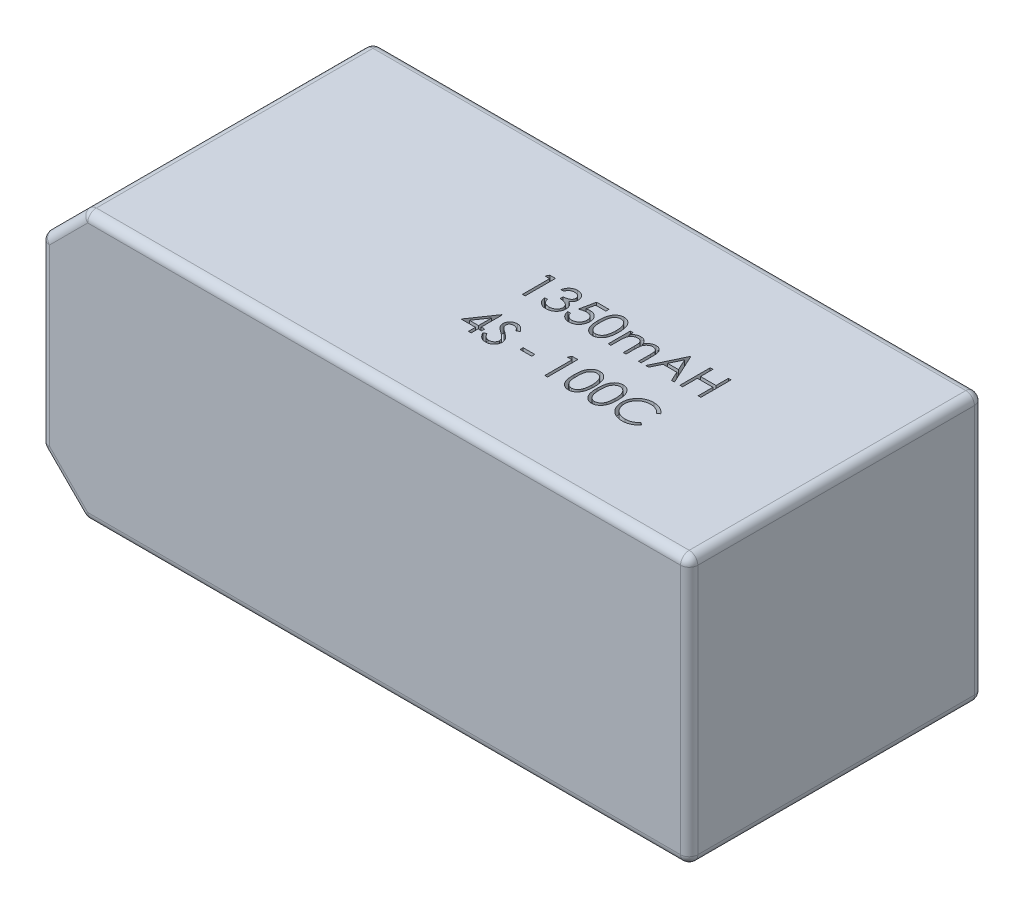
from build123d import *

# Parameters (mm, degrees)
SKETCH1_W           = 75
SKETCH1_H           = 34
BOSS_EXTRUDE1_DEPTH = 15.5
CHAMFER1_SIZE       = 5
FILLET1_R           = 1
SKETCH2_W           = 1.346153846
SKETCH2_H           = 0.358974359
CUT_EXTRUDE1_DEPTH  = 1


with BuildPart() as part:
    # Sketch1 → Boss-Extrude1 (new, symmetric)
    with BuildSketch(Plane(origin=(0, 0, 0), x_dir=(1, 0, 0), z_dir=(0, 1, 0))):
        Rectangle(SKETCH1_W, SKETCH1_H)
    extrude(amount=BOSS_EXTRUDE1_DEPTH, both=True)

    # Chamfer1
    chamfer1_edges = [part.edges().sort_by_distance(p)[0] for p in [
        (-37.5, 15.5, 0),
        (-37.5, -15.5, 0),
    ]]
    chamfer(chamfer1_edges, length=CHAMFER1_SIZE)

    # Fillet1
    fillet1_edges = [part.edges().sort_by_distance(p)[0] for p in [
        (37.5, -15.5, 0),
        (37.5, 15.5, 0),
        (-35, -13, -17),
        (-37.5, 0, -17),
        (-35, 13, -17),
        (2.5, -15.5, -17),
        (37.5, 0, -17),
        (2.5, 15.5, -17),
        (-35, -13, 17),
        (-37.5, 0, 17),
        (-35, 13, 17),
        (37.5, 0, 17),
        (2.5, 15.5, 17),
        (2.5, -15.5, 17),
        (-32.5, -15.5, 0),
        (-37.5, -10.5, 0),
        (-32.5, 15.5, 0),
        (-37.5, 10.5, 0),
    ]]
    fillet(fillet1_edges, radius=FILLET1_R)

    # Sketch2 → Cut-Extrude1 (cut)
    # profile 1 of 14: a face of its own
    with BuildSketch(Plane(origin=(0, 15.5, 0), x_dir=(1, 0, 0), z_dir=(0, 1, 0))):
        Polygon((0.878505609, 3.5), (1.525641026, 3.5), (1.525641026, 0), (1.211538462, 0), (1.211538462, 3.141025641), (0.673076923, 3.141025641), align=None)
    # profile 2 of 14: a face of its own
    with BuildSketch(Plane(origin=(0, 15.5, 0), x_dir=(1, 0, 0), z_dir=(0, 1, 0))):
        with BuildLine():
            Line((3.275641026, 2.692307692), (2.961538462, 2.692307692))
            add(Edge.make_bspline(
                [(2.961538462, 2.692307692), (2.970048012, 2.727540176), (2.986683488, 2.796416801), (3.021381061, 2.894824062), (3.059180316, 2.987947583), (3.104569421, 3.074043657), (3.154078175, 3.154842559), (3.210800897, 3.228511684), (3.272120619, 3.296924649), (3.339945569, 3.357637887), (3.41107423, 3.412615616), (3.48650885, 3.459490673), (3.564731744, 3.499814826), (3.646284877, 3.533035058), (3.731411048, 3.558060582), (3.819340672, 3.576217387), (3.910304172, 3.588008502), (3.972051762, 3.589159265), (4.003405449, 3.58974359)],
                knots=[0, 0, 0, 0, 1.162005537, 2.271625781, 3.343758855, 4.383309926, 5.390229558, 6.379919256, 7.361854164, 8.333198761, 9.295911338, 10.242430842, 11.177959212, 12.116337295, 13.062827104, 14.020064771, 14.994644689, 16, 16, 16, 16], degree=3))
            add(Edge.make_bspline(
                [(4.003405449, 3.58974359), (4.049088191, 3.588364359), (4.139457202, 3.585635984), (4.272220249, 3.560721548), (4.400247068, 3.521296415), (4.522136316, 3.466822688), (4.635354748, 3.399635375), (4.736090935, 3.319670638), (4.822979446, 3.228471337), (4.895873823, 3.127738772), (4.952948822, 3.020083263), (4.995035196, 2.909283106), (5.020656877, 2.795601134), (5.023977434, 2.718843855), (5.025641026, 2.680388622)],
                knots=[0, 0, 0, 0, 1.083050992, 2.142477498, 3.193116406, 4.255571735, 5.30263384, 6.308962982, 7.297363603, 8.282367274, 9.249857812, 10.179914175, 11.08814088, 12, 12, 12, 12], degree=3))
            add(Edge.make_bspline(
                [(5.025641026, 2.680388622), (5.024477435, 2.643381827), (5.022200467, 2.570965273), (5.002866762, 2.465243775), (4.970330499, 2.365602175), (4.925260736, 2.271621013), (4.866919186, 2.183896173), (4.796246489, 2.102230282), (4.712743828, 2.026261124), (4.64946489, 1.982741651), (4.616887019, 1.960336538)],
                knots=[0, 0, 0, 0, 1.024540389, 2.004866551, 2.965041327, 3.920577974, 4.882998113, 5.874504559, 6.905732034, 8, 8, 8, 8], degree=3))
            add(Edge.make_bspline(
                [(4.616887019, 1.960336538), (4.654118774, 1.942358367), (4.727885648, 1.906738409), (4.828436178, 1.836882652), (4.919714053, 1.756226304), (4.970617772, 1.693283652), (4.99619391, 1.661658654)],
                knots=[0, 0, 0, 0, 1.015518401, 2.012035669, 3.001164323, 4, 4, 4, 4], degree=3))
            add(Edge.make_bspline(
                [(4.99619391, 1.661658654), (5.013035253, 1.638600902), (5.046442149, 1.592862986), (5.087677682, 1.51932656), (5.125086797, 1.444975071), (5.154237016, 1.367815664), (5.176810883, 1.288742651), (5.192946915, 1.207620255), (5.202971056, 1.124382232), (5.204406608, 1.068069752), (5.205128205, 1.039763622)],
                knots=[0, 0, 0, 0, 1.025084078, 2.033381695, 3.024893161, 4.013698104, 4.991890475, 5.976764909, 6.982997093, 8, 8, 8, 8], degree=3))
            add(Edge.make_bspline(
                [(5.205128205, 1.039763622), (5.203333692, 0.990753901), (5.19975311, 0.892965099), (5.167749035, 0.748490377), (5.118135795, 0.607264875), (5.047678859, 0.472190036), (4.96181135, 0.345809655), (4.859654026, 0.232733346), (4.742367617, 0.135534741), (4.611561968, 0.054324513), (4.46984484, -0.010593409), (4.318269248, -0.055650852), (4.159019194, -0.084996852), (4.049811896, -0.08814372), (3.994290865, -0.08974359)],
                knots=[0, 0, 0, 0, 0.955779014, 1.907060117, 2.875433937, 3.871313158, 4.872415639, 5.851225146, 6.836215519, 7.83643374, 8.849228613, 9.86973379, 10.916971861, 12, 12, 12, 12], degree=3))
            add(Edge.make_bspline(
                [(3.994290865, -0.08974359), (3.956871565, -0.088875376), (3.88324286, -0.087167022), (3.774999362, -0.075488421), (3.671677662, -0.054158416), (3.573138064, -0.025455111), (3.479293028, 0.010936632), (3.390428923, 0.05625533), (3.305999029, 0.109566832), (3.226800078, 0.171500419), (3.15284151, 0.240781759), (3.086088786, 0.318640769), (3.025428993, 0.403638173), (2.972486355, 0.496761229), (2.924849402, 0.596806487), (2.885668445, 0.705054985), (2.851182877, 0.820539007), (2.835149412, 0.901016747), (2.826923077, 0.942307692)],
                knots=[0, 0, 0, 0, 1.048658725, 2.063410685, 3.046034179, 4.001477787, 4.936774919, 5.862367409, 6.792675028, 7.730719943, 8.675894397, 9.627829632, 10.600096036, 11.597688215, 12.626045268, 13.701542398, 14.82072376, 16, 16, 16, 16], degree=3))
            Line((2.826923077, 0.942307692), (3.141025641, 0.942307692))
            add(Edge.make_bspline(
                [(3.141025641, 0.942307692), (3.149208932, 0.915358679), (3.165126145, 0.862940507), (3.192220443, 0.787500202), (3.223088715, 0.718342149), (3.256203274, 0.654959027), (3.29098172, 0.596726624), (3.329896645, 0.545184755), (3.37006579, 0.498069553), (3.400345144, 0.471524941), (3.415164263, 0.458533654)],
                knots=[0, 0, 0, 0, 1.198163088, 2.33053128, 3.407730985, 4.417276592, 5.372219308, 6.28897303, 7.162600585, 8, 8, 8, 8], degree=3))
            add(Edge.make_bspline(
                [(3.415164263, 0.458533654), (3.434760839, 0.44342532), (3.473893502, 0.413255288), (3.537661733, 0.37475366), (3.604726619, 0.341392634), (3.676541294, 0.315908939), (3.751556064, 0.294331278), (3.830983429, 0.280210759), (3.914122646, 0.270522587), (3.97089041, 0.269667656), (3.99989984, 0.269230769)],
                knots=[0, 0, 0, 0, 0.946170439, 1.889420265, 2.845303464, 3.807233317, 4.801018734, 5.828864929, 6.890507805, 8, 8, 8, 8], degree=3))
            add(Edge.make_bspline(
                [(3.99989984, 0.269230769), (4.032653342, 0.269846674), (4.096699989, 0.271051024), (4.190154849, 0.282126731), (4.279062296, 0.298257144), (4.362435222, 0.323170127), (4.441365729, 0.353950979), (4.514747379, 0.392599384), (4.583543485, 0.437944106), (4.646872891, 0.489483264), (4.703818398, 0.545904759), (4.753957911, 0.60491783), (4.796582573, 0.66627366), (4.830966151, 0.730311781), (4.858116701, 0.79676701), (4.876599902, 0.865825839), (4.889451417, 0.936923105), (4.890498029, 0.985252074), (4.891025641, 1.009615385)],
                knots=[0, 0, 0, 0, 1.217147791, 2.380027433, 3.494444702, 4.572153297, 5.609568379, 6.639424714, 7.649109417, 8.668170816, 9.669597737, 10.625200337, 11.543417969, 12.441394052, 13.322311151, 14.205496177, 15.095365482, 16, 16, 16, 16], degree=3))
            add(Edge.make_bspline(
                [(4.891025641, 1.009615385), (4.889495339, 1.042226723), (4.886442351, 1.107287132), (4.863133772, 1.203004706), (4.824794907, 1.295228118), (4.771122396, 1.382383909), (4.705786667, 1.46315981), (4.629421761, 1.535231293), (4.541393532, 1.594701384), (4.460373663, 1.63579004), (4.388608507, 1.663827115), (4.327193122, 1.68250208), (4.258436519, 1.698315735), (4.18317017, 1.713028007), (4.100826954, 1.725549355), (4.011496516, 1.735991171), (3.915160754, 1.744346212), (3.848469588, 1.748077307), (3.814102564, 1.75)],
                knots=[0, 0, 0, 0, 1.07054697, 2.135767047, 3.216561865, 4.33974944, 5.486079747, 6.621378074, 7.775625952, 8.963672916, 9.598146892, 10.304877434, 11.070270905, 11.915000392, 12.823868403, 13.805723172, 14.86925407, 16, 16, 16, 16], degree=3))
            Line((3.814102564, 1.75), (3.814102564, 2.108974359))
            add(Edge.make_bspline(
                [(3.814102564, 2.108974359), (3.85740373, 2.109709163), (3.942220076, 2.111148463), (4.066114381, 2.128556473), (4.184587693, 2.152637101), (4.295014435, 2.189522293), (4.395663149, 2.23236259), (4.482982751, 2.2822148), (4.555749898, 2.337629549), (4.613610969, 2.399462158), (4.657140198, 2.465777206), (4.688966996, 2.534893864), (4.707767322, 2.607417924), (4.710276989, 2.656912592), (4.711538462, 2.681790865)],
                knots=[0, 0, 0, 0, 1.321986639, 2.589447074, 3.816329219, 5.01088745, 6.139805852, 7.153945165, 8.075214402, 8.924034688, 9.728124013, 10.488707548, 11.240355623, 12, 12, 12, 12], degree=3))
            add(Edge.make_bspline(
                [(4.711538462, 2.681790865), (4.711124051, 2.700068611), (4.7102996, 2.736431318), (4.699902322, 2.789556386), (4.684278281, 2.841057332), (4.662798552, 2.890715142), (4.634048353, 2.938185416), (4.599642366, 2.983872865), (4.558674266, 3.027516644), (4.511728819, 3.068196964), (4.461317014, 3.106966201), (4.406067239, 3.139879838), (4.347645364, 3.1680249), (4.285986709, 3.191234402), (4.220891179, 3.20869369), (4.152664621, 3.221229532), (4.081176938, 3.229067187), (4.032405206, 3.230195602), (4.007612179, 3.230769231)],
                knots=[0, 0, 0, 0, 0.884392785, 1.759457502, 2.611959086, 3.489218968, 4.37281399, 5.2945488, 6.255912374, 7.266815255, 8.301784654, 9.332968512, 10.37626691, 11.440494194, 12.520033166, 13.637162961, 14.798855837, 16, 16, 16, 16], degree=3))
            add(Edge.make_bspline(
                [(4.007612179, 3.230769231), (3.967760511, 3.229377869), (3.889920935, 3.226660215), (3.777706018, 3.202857202), (3.673386684, 3.164879118), (3.593648018, 3.119546099), (3.534765443, 3.074795665), (3.492688505, 3.035713279), (3.451367995, 2.992280455), (3.413522318, 2.94182208), (3.375248341, 2.887755289), (3.34040378, 2.827331608), (3.306544088, 2.762127214), (3.286141538, 2.716031579), (3.275641026, 2.692307692)],
                knots=[0, 0, 0, 0, 1.472543308, 2.876219568, 4.221790263, 5.565193594, 6.249813518, 6.953379497, 7.687249741, 8.463570142, 9.283606569, 10.136032583, 11.040678096, 12, 12, 12, 12], degree=3))
        make_face()
    # profile 3 of 14: a face of its own
    with BuildSketch(Plane(origin=(0, 15.5, 0), x_dir=(1, 0, 0), z_dir=(0, 1, 0))):
        with BuildLine():
            Line((7.717948718, 3.5), (7.717948718, 3.141025641))
            Line((7.717948718, 3.141025641), (6.52744391, 3.141025641))
            Line((6.52744391, 3.141025641), (6.338842147, 2.220452724))
            add(Edge.make_bspline(
                [(6.338842147, 2.220452724), (6.375898022, 2.230682996), (6.447687918, 2.25050253), (6.553647779, 2.2725083), (6.654239982, 2.285773744), (6.719515352, 2.287585055), (6.751101763, 2.288461538)],
                knots=[0, 0, 0, 0, 1.100273476, 2.13160584, 3.095893838, 4, 4, 4, 4], degree=3))
            add(Edge.make_bspline(
                [(6.751101763, 2.288461538), (6.790185503, 2.287615603), (6.8670339, 2.285952282), (6.979472847, 2.269980432), (7.08680574, 2.244840518), (7.18880811, 2.209719996), (7.285668661, 2.164810263), (7.376496222, 2.108710322), (7.462654135, 2.043176991), (7.542596729, 1.967831979), (7.615121037, 1.884910363), (7.678887027, 1.795752492), (7.733049617, 1.701224829), (7.776610372, 1.600424221), (7.811394707, 1.494465067), (7.834546701, 1.382232485), (7.84996341, 1.264784365), (7.851685797, 1.184479795), (7.852564103, 1.143529647)],
                knots=[0, 0, 0, 0, 1.052922333, 2.070308379, 3.05430497, 4.020497103, 4.973039431, 5.925935799, 6.892292201, 7.88610001, 8.88166317, 9.857072816, 10.836096531, 11.812156883, 12.81219415, 13.836441305, 14.89672472, 16, 16, 16, 16], degree=3))
            add(Edge.make_bspline(
                [(7.852564103, 1.143529647), (7.851899027, 1.115007427), (7.850577865, 1.05834844), (7.843859277, 0.974204239), (7.830923561, 0.891841406), (7.813555837, 0.811249014), (7.791013419, 0.732579642), (7.763724365, 0.655608114), (7.730328337, 0.580813507), (7.693696962, 0.507488112), (7.652450484, 0.437289605), (7.606671977, 0.371640618), (7.558306486, 0.309556337), (7.5062651, 0.251702604), (7.450064105, 0.198459586), (7.390384138, 0.149511304), (7.327701419, 0.104029974), (7.261046177, 0.063861779), (7.191903694, 0.026898823), (7.119275477, -0.003424715), (7.044814776, -0.030535243), (6.967449901, -0.05214477), (6.887356088, -0.069077325), (6.804401313, -0.080577925), (6.719020643, -0.088954363), (6.66114563, -0.08947872), (6.631911058, -0.08974359)],
                knots=[0, 0, 0, 0, 1.056347294, 2.098418968, 3.122841568, 4.141288669, 5.149314143, 6.15115421, 7.162517403, 8.180376062, 9.185164535, 10.17417709, 11.141909838, 12.097768115, 13.052685741, 14.0056014, 14.954263652, 15.917497458, 16.885230207, 17.854509472, 18.828990115, 19.81800267, 20.826176721, 21.857883937, 22.917946725, 24, 24, 24, 24], degree=3))
            add(Edge.make_bspline(
                [(6.631911058, -0.08974359), (6.597036877, -0.089052752), (6.528426046, -0.08769361), (6.427905479, -0.073475124), (6.331190874, -0.053111208), (6.239060772, -0.022474938), (6.150689509, 0.015912357), (6.067266791, 0.064428528), (5.986661015, 0.119407632), (5.912148978, 0.184287985), (5.842992865, 0.255203667), (5.781086356, 0.332161308), (5.725952779, 0.41389075), (5.678475032, 0.500788904), (5.637977011, 0.592627435), (5.606162022, 0.689750436), (5.580483667, 0.79165044), (5.569620247, 0.86180395), (5.564102564, 0.897435897)],
                knots=[0, 0, 0, 0, 1.0467383, 2.05933395, 3.04377827, 4.011590433, 4.970194871, 5.932262533, 6.905835911, 7.896367577, 8.894135286, 9.877477877, 10.858688626, 11.851381753, 12.8477658, 13.868841284, 14.917554742, 16, 16, 16, 16], degree=3))
            Line((5.564102564, 0.897435897), (5.878205128, 0.897435897))
            add(Edge.make_bspline(
                [(5.878205128, 0.897435897), (5.885933686, 0.864059445), (5.900788402, 0.79990805), (5.933394151, 0.709776709), (5.973260026, 0.629457485), (6.020664375, 0.557887902), (6.077214405, 0.495478905), (6.141743834, 0.439861843), (6.214091557, 0.389686713), (6.294484787, 0.347863946), (6.379297866, 0.312195193), (6.468065076, 0.288443498), (6.558369423, 0.271742605), (6.619447793, 0.270070844), (6.650140224, 0.269230769)],
                knots=[0, 0, 0, 0, 1.136247022, 2.183929868, 3.172523383, 4.106158343, 5.02341133, 5.958108904, 6.928429099, 7.938127109, 8.96079061, 9.975095812, 10.982467395, 12, 12, 12, 12], degree=3))
            add(Edge.make_bspline(
                [(6.650140224, 0.269230769), (6.680098669, 0.270051547), (6.739087091, 0.271667666), (6.825898478, 0.284106678), (6.909711352, 0.303264249), (6.989698709, 0.331934104), (7.067260248, 0.366778822), (7.140434019, 0.411493898), (7.211336896, 0.462953917), (7.277765029, 0.521910547), (7.338604479, 0.586880241), (7.3923606, 0.656357635), (7.437137513, 0.730474481), (7.474871622, 0.807947634), (7.503524921, 0.889626191), (7.523965902, 0.975127366), (7.535968961, 1.064662347), (7.537620141, 1.125731656), (7.538461538, 1.156850962)],
                knots=[0, 0, 0, 0, 1.027316725, 2.022795036, 3.002884548, 3.971462791, 4.93288096, 5.914575861, 6.907176829, 7.935150275, 8.956128384, 9.956726525, 10.942570165, 11.921478529, 12.907843606, 13.90538589, 14.932640048, 16, 16, 16, 16], degree=3))
            add(Edge.make_bspline(
                [(7.538461538, 1.156850962), (7.537803059, 1.184926713), (7.536514179, 1.239881002), (7.525983609, 1.320280209), (7.507666636, 1.396353251), (7.482242757, 1.468467485), (7.449963249, 1.536690927), (7.410516936, 1.601093987), (7.363163539, 1.660827821), (7.30907165, 1.715920374), (7.249813609, 1.766765249), (7.184369866, 1.810109336), (7.11410994, 1.846573253), (7.03988034, 1.878041252), (6.959915442, 1.900641997), (6.875798809, 1.917609882), (6.786622101, 1.927425245), (6.725651413, 1.928787134), (6.694310897, 1.929487179)],
                knots=[0, 0, 0, 0, 1.045622112, 2.046656509, 3.013763289, 3.955457236, 4.890082067, 5.820317437, 6.762574623, 7.722996705, 8.69280354, 9.665887285, 10.63943826, 11.638615906, 12.663482002, 13.728887084, 14.832589034, 16, 16, 16, 16], degree=3))
            add(Edge.make_bspline(
                [(6.694310897, 1.929487179), (6.667181969, 1.928906588), (6.611167613, 1.927707815), (6.525244787, 1.918881318), (6.434953064, 1.904642024), (6.340638568, 1.885055776), (6.24201806, 1.859424699), (6.139299659, 1.828710199), (6.032267393, 1.7919882), (5.960149668, 1.764255986), (5.923076923, 1.75)],
                knots=[0, 0, 0, 0, 0.817624296, 1.688186739, 2.600797293, 3.572016777, 4.590301741, 5.671205678, 6.80286297, 8, 8, 8, 8], degree=3))
            Line((5.923076923, 1.75), (6.282051282, 3.5))
            Line((6.282051282, 3.5), (7.717948718, 3.5))
        make_face()
    # profile 4 of 14: a face of its own
    with BuildSketch(Plane(origin=(0, 15.5, 0), x_dir=(1, 0, 0), z_dir=(0, 1, 0))):
        with BuildLine():
            add(Edge.make_bspline(
                [(8.211538462, 1.748597756), (8.21186648, 1.804695144), (8.21250366, 1.913665128), (8.219592081, 2.07244977), (8.231367423, 2.221410059), (8.247504796, 2.360553125), (8.267142776, 2.48991489), (8.293358263, 2.609149647), (8.323171065, 2.718809254), (8.357723511, 2.819251302), (8.3967113, 2.911829005), (8.439145561, 2.998254207), (8.486710355, 3.078396139), (8.536687268, 3.153533929), (8.59109934, 3.222437624), (8.64839813, 3.286080287), (8.710820007, 3.342991037), (8.776243015, 3.394837339), (8.845259479, 3.440286811), (8.915902145, 3.48031955), (8.988657251, 3.514519417), (9.063723434, 3.541409853), (9.140425992, 3.5636207), (9.219033059, 3.578809647), (9.299674423, 3.588366556), (9.354105857, 3.589280224), (9.381710737, 3.58974359)],
                knots=[0, 0, 0, 0, 1.646270934, 3.197905019, 4.663502075, 6.030701355, 7.308322542, 8.50163776, 9.611534131, 10.641858119, 11.616356847, 12.558055219, 13.465016945, 14.349605745, 15.204443733, 16.039544428, 16.859896111, 17.680448484, 18.487036065, 19.28249412, 20.06191084, 20.843045899, 21.620316918, 22.403196591, 23.190181807, 24, 24, 24, 24], degree=3))
            add(Edge.make_bspline(
                [(9.381710737, 3.58974359), (9.409546216, 3.589255775), (9.464902225, 3.588285664), (9.5467426, 3.578961721), (9.626692282, 3.563490598), (9.70441042, 3.541569623), (9.780535407, 3.514373947), (9.854471814, 3.48028683), (9.926678896, 3.440607962), (9.996009183, 3.393984085), (10.063223799, 3.342001809), (10.126671762, 3.28323914), (10.186358848, 3.218289421), (10.243034153, 3.147847557), (10.29508975, 3.070562472), (10.344663183, 2.987778362), (10.389035218, 2.898047497), (10.431769894, 2.80286703), (10.46865688, 2.699603371), (10.501923126, 2.58883861), (10.528802094, 2.469264423), (10.551191367, 2.341508178), (10.568536262, 2.205100695), (10.581168905, 2.060334379), (10.58784199, 1.907113989), (10.589098691, 1.80235614), (10.58974359, 1.748597756)],
                knots=[0, 0, 0, 0, 0.810914788, 1.612654377, 2.396697861, 3.181598691, 3.963628158, 4.749916497, 5.551656086, 6.361998678, 7.18212741, 8.025565596, 8.878627764, 9.750805457, 10.657531673, 11.591944965, 12.560506719, 13.57287815, 14.630710178, 15.753379473, 16.941251878, 18.199788006, 19.531962791, 20.947069417, 22.433333509, 24, 24, 24, 24], degree=3))
            add(Edge.make_bspline(
                [(10.58974359, 1.748597756), (10.589092005, 1.695073848), (10.587822419, 1.590784697), (10.581243713, 1.438253721), (10.568285081, 1.294255678), (10.552075093, 1.158445216), (10.52962413, 1.031387597), (10.502018964, 0.912643148), (10.471368641, 0.801699077), (10.433533847, 0.699464265), (10.392123137, 0.604512542), (10.34706794, 0.515845394), (10.298798114, 0.432679101), (10.246209369, 0.355679354), (10.190155956, 0.284300697), (10.129438167, 0.219803074), (10.065767582, 0.160632402), (9.998355166, 0.107980775), (9.927943615, 0.06189597), (9.855984538, 0.02068212), (9.781201155, -0.012550575), (9.705288202, -0.041085616), (9.627159836, -0.062886068), (9.546913445, -0.077959923), (9.464957209, -0.088531772), (9.409555644, -0.089338252), (9.381710737, -0.08974359)],
                knots=[0, 0, 0, 0, 1.561518951, 3.042555995, 4.452378317, 5.7783523, 7.031515105, 8.214008947, 9.334062868, 10.386615937, 11.391082383, 12.354592575, 13.286541444, 14.194233754, 15.072674879, 15.931287219, 16.775624067, 17.606195743, 18.42308326, 19.229000347, 20.022332153, 20.807536673, 21.593273796, 22.3848459, 23.188221202, 24, 24, 24, 24], degree=3))
            add(Edge.make_bspline(
                [(9.381710737, -0.08974359), (9.354106623, -0.089277234), (9.299676698, -0.088357672), (9.219024273, -0.078843941), (9.14074183, -0.063548438), (9.064443076, -0.042131834), (8.98973656, -0.015916997), (8.917640274, 0.018236686), (8.84735259, 0.057570755), (8.779061034, 0.102366177), (8.714048873, 0.15368786), (8.651950268, 0.210452149), (8.594325249, 0.27407556), (8.540691153, 0.343553483), (8.489717065, 0.418246725), (8.442827691, 0.499175098), (8.399456837, 0.586017709), (8.359813347, 0.67933562), (8.324664683, 0.780490547), (8.293616975, 0.890639726), (8.269102818, 1.010755362), (8.248119862, 1.139872729), (8.231195479, 1.278546659), (8.219641154, 1.426852438), (8.212499839, 1.584697647), (8.211864768, 1.692967421), (8.211538462, 1.748597756)],
                knots=[0, 0, 0, 0, 0.810891512, 1.598919785, 2.382837074, 3.152667961, 3.926044502, 4.706494248, 5.493654104, 6.291793342, 7.103789334, 7.925228297, 8.761435821, 9.622817696, 10.50288917, 11.416980706, 12.369136599, 13.353924996, 14.394355917, 15.514179734, 16.714354668, 17.994756427, 19.357759367, 20.818452758, 22.365282078, 24, 24, 24, 24], degree=3))
        make_face()
        with BuildLine():
            add(Edge.make_bspline(
                [(8.525641026, 1.75), (8.525760473, 1.703251301), (8.525992296, 1.612521256), (8.532048497, 1.480677995), (8.540298729, 1.357707667), (8.550940026, 1.24345413), (8.566742974, 1.138304118), (8.584449762, 1.041534435), (8.605997852, 0.953657197), (8.63149287, 0.874069387), (8.660531966, 0.801420318), (8.69223783, 0.733819103), (8.726298553, 0.670467167), (8.764417704, 0.611933558), (8.805932767, 0.558027394), (8.849906026, 0.507794562), (8.89797861, 0.462997581), (8.964482353, 0.409270726), (9.052278827, 0.353751592), (9.162899282, 0.305405502), (9.276567733, 0.275023046), (9.353718984, 0.27115929), (9.392227564, 0.269230769)],
                knots=[0, 0, 0, 0, 1.459021318, 2.831673884, 4.118529203, 5.306027144, 6.411944654, 7.436330062, 8.375795394, 9.233974572, 10.042671642, 10.816086306, 11.563610507, 12.285937304, 12.993564865, 13.685989202, 14.367179055, 15.041617293, 16.353048772, 17.594441528, 18.799311195, 20, 20, 20, 20], degree=3))
            add(Edge.make_bspline(
                [(9.392227564, 0.269230769), (9.430985236, 0.27082855), (9.508420559, 0.274020813), (9.621554354, 0.30481955), (9.731384624, 0.35128909), (9.817456564, 0.406236595), (9.882939108, 0.458564925), (9.929856098, 0.503179573), (9.972918146, 0.55313544), (10.013760221, 0.607034736), (10.051219297, 0.66590722), (10.085282435, 0.729469796), (10.116365782, 0.797898973), (10.134074828, 0.845668713), (10.143129006, 0.870092147)],
                knots=[0, 0, 0, 0, 1.353760809, 2.704726607, 4.075137775, 5.516104923, 6.260822281, 7.007110065, 7.778089737, 8.566572457, 9.372053459, 10.217411131, 11.088608312, 12, 12, 12, 12], degree=3))
            add(Edge.make_bspline(
                [(10.143129006, 0.870092147), (10.153680774, 0.901321887), (10.175105388, 0.964731651), (10.202717162, 1.063095303), (10.224462562, 1.166298067), (10.244025927, 1.273723184), (10.257378983, 1.386162885), (10.268126796, 1.503269269), (10.274457483, 1.625130631), (10.275242234, 1.707925622), (10.275641026, 1.75)],
                knots=[0, 0, 0, 0, 0.884706709, 1.796334032, 2.740027952, 3.714592787, 4.726048262, 5.777819803, 6.87074269, 8, 8, 8, 8], degree=3))
            add(Edge.make_bspline(
                [(10.275641026, 1.75), (10.275090836, 1.792067573), (10.274014549, 1.874360737), (10.269900561, 1.994878918), (10.259276986, 2.109346679), (10.247477868, 2.218257152), (10.230080647, 2.321007454), (10.21132284, 2.418457759), (10.186121627, 2.509400784), (10.159201852, 2.595260366), (10.128391457, 2.675061021), (10.094475723, 2.749174807), (10.058253964, 2.817959532), (10.018911723, 2.881226473), (9.97691604, 2.939259016), (9.931158491, 2.990893611), (9.883454118, 3.037730579), (9.816636932, 3.091193148), (9.729162643, 3.145704843), (9.620316995, 3.195870603), (9.507046351, 3.224678896), (9.430472897, 3.228740583), (9.392227564, 3.230769231)],
                knots=[0, 0, 0, 0, 1.31362396, 2.569729283, 3.763502607, 4.902122613, 5.988968491, 7.01645872, 7.998833611, 8.933434873, 9.825090667, 10.667526885, 11.477055099, 12.250526234, 12.991942729, 13.710640831, 14.402115721, 15.076753259, 16.378508321, 17.609869233, 18.806226677, 20, 20, 20, 20], degree=3))
            add(Edge.make_bspline(
                [(9.392227564, 3.230769231), (9.353516972, 3.228737784), (9.276025266, 3.22467119), (9.161577312, 3.195977936), (9.05187296, 3.14596497), (8.964629985, 3.091012598), (8.897766199, 3.038674287), (8.850683505, 2.993287833), (8.806537333, 2.943641578), (8.765869633, 2.889239663), (8.72778035, 2.830774296), (8.692799337, 2.767785531), (8.661282008, 2.699954167), (8.632197471, 2.627337732), (8.606624683, 2.547756787), (8.58553072, 2.459987794), (8.566043667, 2.363525902), (8.552248398, 2.257806394), (8.539984642, 2.14352424), (8.532103295, 2.020246922), (8.525972037, 1.888182542), (8.525753573, 1.796983383), (8.525641026, 1.75)],
                knots=[0, 0, 0, 0, 1.207732386, 2.417664972, 3.655092373, 4.956220595, 5.625982001, 6.301752483, 6.994047911, 7.697131622, 8.419323945, 9.170223765, 9.943494443, 10.752040957, 11.610060368, 12.549350801, 13.567764191, 14.679664412, 15.874934091, 17.154273443, 18.533957287, 20, 20, 20, 20], degree=3))
        make_face(mode=Mode.SUBTRACT)
    # profile 5 of 14: a face of its own
    with BuildSketch(Plane(origin=(0, 15.5, 0), x_dir=(1, 0, 0), z_dir=(0, 1, 0))):
        with BuildLine():
            Line((11.128205128, 2.557692308), (11.442307692, 2.557692308))
            Line((11.442307692, 2.557692308), (11.442307692, 2.11318109))
            add(Edge.make_bspline(
                [(11.442307692, 2.11318109), (11.470591642, 2.152068691), (11.524786402, 2.226581065), (11.613652054, 2.324771349), (11.702428167, 2.408099503), (11.766361549, 2.451842375), (11.797075321, 2.472856571)],
                knots=[0, 0, 0, 0, 1.134379233, 2.173579362, 3.122582517, 4, 4, 4, 4], degree=3))
            add(Edge.make_bspline(
                [(11.797075321, 2.472856571), (11.838939983, 2.492861936), (11.921937882, 2.532523149), (12.053357107, 2.572756708), (12.187831777, 2.597481809), (12.278639991, 2.600863183), (12.32431891, 2.602564103)],
                knots=[0, 0, 0, 0, 1.014936303, 2.012140481, 3.000054389, 4, 4, 4, 4], degree=3))
            add(Edge.make_bspline(
                [(12.32431891, 2.602564103), (12.355211907, 2.601518812), (12.416347486, 2.599450238), (12.506931576, 2.585990202), (12.594790188, 2.562724029), (12.679404217, 2.530316705), (12.759124896, 2.491070018), (12.832214094, 2.445020311), (12.897838302, 2.393323235), (12.955964354, 2.333644302), (13.008233379, 2.264307704), (13.056312226, 2.183443455), (13.100737438, 2.089235794), (13.125358747, 2.020869253), (13.138321314, 1.984875801)],
                knots=[0, 0, 0, 0, 1.009824226, 1.998387844, 2.986035974, 3.974953746, 4.955485308, 5.885931332, 6.793869504, 7.679848016, 8.601185859, 9.625726857, 10.749998409, 12, 12, 12, 12], degree=3))
            add(Edge.make_bspline(
                [(13.138321314, 1.984875801), (13.152032565, 2.009600221), (13.179014383, 2.058254406), (13.22432002, 2.127112668), (13.271787816, 2.19151946), (13.321822309, 2.251525884), (13.374246896, 2.306835614), (13.429308296, 2.357631516), (13.486693078, 2.40413173), (13.566485318, 2.458454889), (13.670297925, 2.516156071), (13.80118604, 2.566184515), (13.937336211, 2.597100643), (14.02975391, 2.600730916), (14.076422276, 2.602564103)],
                knots=[0, 0, 0, 0, 0.86119277, 1.694706429, 2.50939023, 3.298075842, 4.073795165, 4.829715201, 5.57930267, 6.321991688, 7.768977793, 9.186738141, 10.579381044, 12, 12, 12, 12], degree=3))
            add(Edge.make_bspline(
                [(14.076422276, 2.602564103), (14.119303738, 2.600946882), (14.203226925, 2.597781823), (14.32540419, 2.57292835), (14.439345996, 2.530250703), (14.544823072, 2.472017066), (14.639982885, 2.398837883), (14.722699194, 2.311769046), (14.792469558, 2.211426423), (14.838048198, 2.117034434), (14.868963462, 2.033699101), (14.888024696, 1.96269281), (14.904864391, 1.884541257), (14.918845636, 1.799150995), (14.929064189, 1.706220387), (14.936634904, 1.605901511), (14.941758978, 1.498116399), (14.94212105, 1.423750899), (14.942307692, 1.385416667)],
                knots=[0, 0, 0, 0, 1.209669288, 2.367440248, 3.500751976, 4.631527125, 5.755587489, 6.87532382, 8.007944318, 9.190864318, 9.82315674, 10.514484317, 11.263564316, 12.079023757, 12.955305781, 13.901327259, 14.918167583, 16, 16, 16, 16], degree=3))
            Line((14.942307692, 1.385416667), (14.942307692, 0))
            Line((14.942307692, 0), (14.628205128, 0))
            Line((14.628205128, 0), (14.628205128, 1.38681891))
            add(Edge.make_bspline(
                [(14.628205128, 1.38681891), (14.628127245, 1.419539484), (14.627977566, 1.482423451), (14.625283934, 1.572675902), (14.62020862, 1.654944259), (14.614273982, 1.729116348), (14.606030172, 1.795365136), (14.59538424, 1.853557555), (14.584106561, 1.904151366), (14.565370569, 1.960237414), (14.535422678, 2.022107624), (14.489805198, 2.0888312), (14.432335092, 2.146912), (14.365974935, 2.197330317), (14.29042649, 2.238323958), (14.207161767, 2.267599968), (14.116697716, 2.285722846), (14.054074927, 2.287528862), (14.021734776, 2.288461538)],
                knots=[0, 0, 0, 0, 1.253487763, 2.409012846, 3.458416907, 4.410876679, 5.259312806, 6.014470957, 6.676830364, 7.243083969, 8.276244668, 9.299465089, 10.325150304, 11.392391894, 12.482080715, 13.603491619, 14.762376348, 16, 16, 16, 16], degree=3))
            add(Edge.make_bspline(
                [(14.021734776, 2.288461538), (13.982064821, 2.287045381), (13.90366191, 2.284246516), (13.789216424, 2.255672643), (13.679245407, 2.212592392), (13.577030274, 2.150159935), (13.483002484, 2.075351571), (13.402102906, 1.986401975), (13.33527072, 1.885772048), (13.290016744, 1.792625346), (13.261427443, 1.708955902), (13.242550527, 1.63585853), (13.227867136, 1.552776962), (13.214096607, 1.460269472), (13.205108879, 1.357699291), (13.196940506, 1.24554089), (13.193119644, 1.123456931), (13.192585185, 1.038830242), (13.192307692, 0.994891827)],
                knots=[0, 0, 0, 0, 1.090531906, 2.155305635, 3.229839962, 4.33261226, 5.44038871, 6.529323825, 7.629011124, 8.757537029, 9.370236727, 10.061839251, 10.834451254, 11.692844982, 12.636905849, 13.66920014, 14.789842145, 16, 16, 16, 16], degree=3))
            Line((13.192307692, 0.994891827), (13.192307692, 0))
            Line((13.192307692, 0), (12.878205128, 0))
            Line((12.878205128, 0), (12.878205128, 1.300580929))
            add(Edge.make_bspline(
                [(12.878205128, 1.300580929), (12.878125697, 1.337274248), (12.87797288, 1.407868505), (12.875296563, 1.509102181), (12.870209941, 1.601183261), (12.864329393, 1.684004725), (12.855869214, 1.757416053), (12.846259452, 1.821810811), (12.834910841, 1.877027563), (12.816120957, 1.937590947), (12.787406489, 2.00431187), (12.741218227, 2.075452892), (12.683610646, 2.137720989), (12.61603977, 2.190879738), (12.540034088, 2.234821219), (12.456050687, 2.266480971), (12.364845775, 2.28490526), (12.301968069, 2.287253757), (12.26963141, 2.288461538)],
                knots=[0, 0, 0, 0, 1.320475261, 2.540461679, 3.643808994, 4.639130445, 5.527981419, 6.302341397, 6.981980563, 7.553956391, 8.582137848, 9.585246428, 10.591171744, 11.620968678, 12.668337649, 13.738356861, 14.836885341, 16, 16, 16, 16], degree=3))
            add(Edge.make_bspline(
                [(12.26963141, 2.288461538), (12.231615199, 2.286931078), (12.155850239, 2.283880926), (12.04454827, 2.256426652), (11.937062586, 2.213422577), (11.835107887, 2.153762758), (11.741433739, 2.07986368), (11.659425472, 1.992948784), (11.590482946, 1.89409975), (11.544751131, 1.801935234), (11.515252657, 1.720361959), (11.495657323, 1.651011011), (11.478817697, 1.574010763), (11.466303675, 1.489123652), (11.454223259, 1.396902558), (11.44839295, 1.296888068), (11.442721388, 1.18916598), (11.442448973, 1.114793435), (11.442307692, 1.076221955)],
                knots=[0, 0, 0, 0, 1.098833095, 2.189935336, 3.297829714, 4.440610912, 5.596351641, 6.740013378, 7.886572111, 9.072425424, 9.705826452, 10.395263256, 11.156850408, 11.985370555, 12.878090359, 13.847760091, 14.883794034, 16, 16, 16, 16], degree=3))
            Line((11.442307692, 1.076221955), (11.442307692, 0))
            Line((11.442307692, 0), (11.128205128, 0))
            Line((11.128205128, 0), (11.128205128, 2.557692308))
        make_face()
    # profile 6 of 14: a face of its own
    with BuildSketch(Plane(origin=(0, 15.5, 0), x_dir=(1, 0, 0), z_dir=(0, 1, 0))):
        Polygon((17.185897436, 3.5), (18.801282051, 0), (18.459835737, 0), (17.942407853, 1.121794872), (16.355769231, 1.121794872), (15.823617788, 0), (15.480769231, 0), (17.141025641, 3.5), align=None)
        Polygon((17.159955929, 2.817808494), (16.526141827, 1.480769231), (17.776943109, 1.480769231), align=None, mode=Mode.SUBTRACT)
    # profile 7 of 14: a face of its own
    with BuildSketch(Plane(origin=(0, 15.5, 0), x_dir=(1, 0, 0), z_dir=(0, 1, 0))):
        Polygon((19.429487179, 3.5), (19.743589744, 3.5), (19.743589744, 2.064102564), (21.538461538, 2.064102564), (21.538461538, 3.5), (21.852564103, 3.5), (21.852564103, 0), (21.538461538, 0), (21.538461538, 1.705128205), (19.743589744, 1.705128205), (19.743589744, 0), (19.429487179, 0), align=None)
    # profile 8 of 14: a face of its own
    with BuildSketch(Plane(origin=(0, 15.5, 0), x_dir=(1, 0, 0), z_dir=(0, 1, 0))):
        Polygon((2.045172276, -3.243589744), (2.108974359, -3.243589744), (2.108974359, -5.666666667), (2.512820513, -5.666666667), (2.512820513, -6.025641026), (2.108974359, -6.025641026), (2.108974359, -6.833333333), (1.794871795, -6.833333333), (1.794871795, -6.025641026), (0.134615385, -6.025641026), align=None)
        Polygon((1.794871795, -5.666666667), (1.794871795, -4.146634615), (0.751602564, -5.666666667), align=None, mode=Mode.SUBTRACT)
    # profile 9 of 14: a face of its own
    with BuildSketch(Plane(origin=(0, 15.5, 0), x_dir=(1, 0, 0), z_dir=(0, 1, 0))):
        with BuildLine():
            Line((2.782051282, -6.158153045), (3.077924679, -5.980769231))
            add(Edge.make_bspline(
                [(3.077924679, -5.980769231), (3.105442917, -6.026833616), (3.158166797, -6.1150912), (3.246118157, -6.23434924), (3.337251068, -6.335711397), (3.432240401, -6.418588004), (3.530506349, -6.483836891), (3.632690403, -6.530039123), (3.738448214, -6.558855098), (3.810422035, -6.562355185), (3.846354167, -6.564102564)],
                knots=[0, 0, 0, 0, 1.272034388, 2.437168799, 3.508375237, 4.49857839, 5.41946034, 6.295179144, 7.148887113, 8, 8, 8, 8], degree=3))
            add(Edge.make_bspline(
                [(3.846354167, -6.564102564), (3.877041027, -6.563247892), (3.9378778, -6.561553501), (4.027440043, -6.545272699), (4.114421845, -6.52026057), (4.197030483, -6.484439639), (4.274126098, -6.441101153), (4.341732793, -6.388754976), (4.400178906, -6.33014877), (4.447988021, -6.264766115), (4.484668056, -6.194448967), (4.512860124, -6.122273015), (4.528505198, -6.047104447), (4.530861952, -5.996493984), (4.532051282, -5.970953526)],
                knots=[0, 0, 0, 0, 1.095163259, 2.171163733, 3.241058638, 4.321873601, 5.38011039, 6.391990106, 7.366004449, 8.327778327, 9.272591725, 10.192022065, 11.087607919, 12, 12, 12, 12], degree=3))
            add(Edge.make_bspline(
                [(4.532051282, -5.970953526), (4.530576971, -5.941812676), (4.527579913, -5.882573587), (4.502248433, -5.795173934), (4.462399186, -5.708681364), (4.425636543, -5.655180098), (4.406550481, -5.627403846)],
                knots=[0, 0, 0, 0, 0.938893495, 1.908633276, 2.914225137, 4, 4, 4, 4], degree=3))
            add(Edge.make_bspline(
                [(4.406550481, -5.627403846), (4.390879867, -5.607357023), (4.357981372, -5.565271224), (4.30142386, -5.502625989), (4.235057745, -5.43800757), (4.16115419, -5.368948513), (4.077021102, -5.298660716), (3.985293587, -5.223792438), (3.883629728, -5.147190861), (3.812330232, -5.095818295), (3.775540865, -5.069310897)],
                knots=[0, 0, 0, 0, 0.722233717, 1.516239348, 2.393582979, 3.351407094, 4.387010283, 5.505090956, 6.712668013, 8, 8, 8, 8], degree=3))
            add(Edge.make_bspline(
                [(3.775540865, -5.069310897), (3.738716869, -5.04308231), (3.668312193, -4.992935248), (3.56985361, -4.918510964), (3.481809147, -4.850467094), (3.404570131, -4.788163082), (3.338170534, -4.731590477), (3.282087123, -4.681292538), (3.237748566, -4.635908977), (3.213092985, -4.606467635), (3.202023237, -4.593249199)],
                knots=[0, 0, 0, 0, 1.452282411, 2.77665338, 3.964542531, 5.026858415, 5.96415736, 6.766646006, 7.446254459, 8, 8, 8, 8], degree=3))
            add(Edge.make_bspline(
                [(3.202023237, -4.593249199), (3.186550692, -4.572648162), (3.156121855, -4.532133458), (3.11595585, -4.4688086), (3.081816687, -4.403985335), (3.055054355, -4.33748947), (3.032518136, -4.270254541), (3.017360205, -4.201403296), (3.007868808, -4.131244677), (3.006896822, -4.084031177), (3.006410256, -4.060396635)],
                knots=[0, 0, 0, 0, 1.068054152, 2.10047183, 3.106115577, 4.101338837, 5.06977816, 6.043150881, 7.020423561, 8, 8, 8, 8], degree=3))
            add(Edge.make_bspline(
                [(3.006410256, -4.060396635), (3.007715465, -4.02336686), (3.010297985, -3.950098796), (3.032138503, -3.843067966), (3.066611396, -3.740881549), (3.114906284, -3.644551215), (3.177163637, -3.556585234), (3.249209612, -3.475971747), (3.335021098, -3.408203165), (3.429173721, -3.348991106), (3.532230093, -3.302645181), (3.640220997, -3.267684201), (3.753318069, -3.247874943), (3.829921203, -3.245032178), (3.868790064, -3.243589744)],
                knots=[0, 0, 0, 0, 1.005424448, 1.989358655, 2.955360095, 3.929531133, 4.905563448, 5.876582895, 6.856512386, 7.866279853, 8.892233794, 9.918561126, 10.94386622, 12, 12, 12, 12], degree=3))
            add(Edge.make_bspline(
                [(3.868790064, -3.243589744), (3.910034164, -3.245012295), (3.992055516, -3.247841296), (4.112704732, -3.272438828), (4.228865448, -3.313139499), (4.322308713, -3.359328157), (4.395441474, -3.405459573), (4.451214207, -3.447479397), (4.507731658, -3.495854506), (4.565449713, -3.550713752), (4.623390372, -3.612560503), (4.682413824, -3.680971192), (4.742658093, -3.755527748), (4.781413953, -3.808752249), (4.801282051, -3.83603766)],
                knots=[0, 0, 0, 0, 1.286793592, 2.559021753, 3.825965368, 5.121522368, 5.803751409, 6.523245864, 7.299691795, 8.125521123, 9.008227632, 9.944561021, 10.946284179, 12, 12, 12, 12], degree=3))
            Line((4.801282051, -3.83603766), (4.517327724, -4.051282051))
            add(Edge.make_bspline(
                [(4.517327724, -4.051282051), (4.500181792, -4.029193361), (4.467162735, -3.986655708), (4.417033248, -3.927084392), (4.3697846, -3.872667912), (4.3232342, -3.825402784), (4.279840569, -3.782700651), (4.237723527, -3.746140894), (4.197489175, -3.715365299), (4.146772265, -3.682521739), (4.083054546, -3.649965235), (4.00307001, -3.622416157), (3.919483735, -3.605861095), (3.862554104, -3.603672208), (3.833733974, -3.602564103)],
                knots=[0, 0, 0, 0, 1.181633172, 2.275549214, 3.290209073, 4.226197932, 5.078386478, 5.862611352, 6.581680152, 7.217281963, 8.414376989, 9.595101626, 10.782541182, 12, 12, 12, 12], degree=3))
            add(Edge.make_bspline(
                [(3.833733974, -3.602564103), (3.797577452, -3.603775803), (3.727853005, -3.606112452), (3.628862768, -3.631632437), (3.539768843, -3.671814297), (3.463216278, -3.728129275), (3.399479301, -3.794850268), (3.353373843, -3.871629123), (3.325623678, -3.956411526), (3.322237398, -4.015553182), (3.320512821, -4.045673077)],
                knots=[0, 0, 0, 0, 1.14458467, 2.207223713, 3.21896685, 4.227309161, 5.202851033, 6.127160689, 7.046193047, 8, 8, 8, 8], degree=3))
            add(Edge.make_bspline(
                [(3.320512821, -4.045673077), (3.320905947, -4.064424555), (3.321692843, -4.101958175), (3.332667641, -4.157409597), (3.34676697, -4.212720936), (3.369109602, -4.267643519), (3.399954905, -4.323137878), (3.440460081, -4.380159616), (3.491473393, -4.439211324), (3.530550406, -4.477618698), (3.551181891, -4.497896635)],
                knots=[0, 0, 0, 0, 0.858281714, 1.717966888, 2.583508476, 3.4729293, 4.427298488, 5.488583878, 6.674047936, 8, 8, 8, 8], degree=3))
            add(Edge.make_bspline(
                [(3.551181891, -4.497896635), (3.558843263, -4.50473366), (3.577044931, -4.520976869), (3.610320856, -4.547569149), (3.654263655, -4.580371922), (3.707725856, -4.620959238), (3.771693217, -4.6680407), (3.846172774, -4.721014312), (3.930334306, -4.781599771), (3.990056222, -4.823957312), (4.021634615, -4.846354167)],
                knots=[0, 0, 0, 0, 0.420754252, 0.999615792, 1.744751191, 2.668019286, 3.750313428, 4.999500688, 6.413464383, 8, 8, 8, 8], degree=3))
            add(Edge.make_bspline(
                [(4.021634615, -4.846354167), (4.059620529, -4.873995526), (4.133174985, -4.927519188), (4.237832565, -5.007934868), (4.332726373, -5.086582637), (4.418189577, -5.162960244), (4.495066485, -5.236488337), (4.562504206, -5.308051517), (4.621189886, -5.37713709), (4.684369105, -5.465709665), (4.748926924, -5.57449075), (4.804368432, -5.707768988), (4.839326779, -5.841565309), (4.843898294, -5.931492145), (4.846153846, -5.975861378)],
                knots=[0, 0, 0, 0, 1.163667725, 2.253281268, 3.268753668, 4.215851969, 5.092017293, 5.902905408, 6.650798638, 7.335211899, 8.59617414, 9.77448103, 10.901945474, 12, 12, 12, 12], degree=3))
            add(Edge.make_bspline(
                [(4.846153846, -5.975861378), (4.845496708, -6.007239743), (4.844195193, -6.069387127), (4.829234279, -6.160642204), (4.807314614, -6.249273073), (4.77427738, -6.334184186), (4.733954222, -6.416928949), (4.682787974, -6.495336849), (4.623480289, -6.571143248), (4.555446524, -6.642326739), (4.481000622, -6.707672935), (4.402316927, -6.765801996), (4.319266654, -6.81427032), (4.232300338, -6.853821162), (4.141398001, -6.884754679), (4.046590217, -6.907167548), (3.947720706, -6.920923259), (3.880520224, -6.922351021), (3.846354167, -6.923076923)],
                knots=[0, 0, 0, 0, 0.983748083, 1.948392443, 2.894712957, 3.844097841, 4.80183111, 5.778335162, 6.776009319, 7.81870978, 8.863265674, 9.881300176, 10.883814829, 11.87499822, 12.874611388, 13.892143829, 14.928324115, 16, 16, 16, 16], degree=3))
            add(Edge.make_bspline(
                [(3.846354167, -6.923076923), (3.819918824, -6.922565741), (3.767381064, -6.921549816), (3.689671582, -6.912568536), (3.613531993, -6.899861432), (3.539917711, -6.879687362), (3.467880299, -6.855210385), (3.397733064, -6.825072052), (3.329442011, -6.788954851), (3.262624428, -6.747659826), (3.197450253, -6.699602082), (3.134530785, -6.643628585), (3.0718016, -6.58128308), (3.011114203, -6.510872517), (2.951241059, -6.433534434), (2.893362649, -6.348545251), (2.836280932, -6.256367897), (2.800465464, -6.191502811), (2.782051282, -6.158153045)],
                knots=[0, 0, 0, 0, 0.915332311, 1.819136955, 2.706846663, 3.586547465, 4.459518054, 5.340707479, 6.227863349, 7.133153174, 8.059268498, 9.028702269, 10.047606654, 11.120612155, 12.245963614, 13.433783089, 14.680604001, 16, 16, 16, 16], degree=3))
        make_face()
    # profile 10 of 14: a face of its own
    with BuildSketch(Plane(origin=(0, 15.5, 0), x_dir=(1, 0, 0), z_dir=(0, 1, 0))):
        with Locations((7.269230769, -5.487179488)):
            Rectangle(SKETCH2_W, SKETCH2_H)
    # profile 11 of 14: a face of its own
    with BuildSketch(Plane(origin=(0, 15.5, 0), x_dir=(1, 0, 0), z_dir=(0, 1, 0))):
        Polygon((10.301582532, -3.333333333), (10.948717949, -3.333333333), (10.948717949, -6.833333333), (10.634615385, -6.833333333), (10.634615385, -3.692307692), (10.096153846, -3.692307692), align=None)
    # profile 12 of 14: a face of its own
    with BuildSketch(Plane(origin=(0, 15.5, 0), x_dir=(1, 0, 0), z_dir=(0, 1, 0))):
        with BuildLine():
            add(Edge.make_bspline(
                [(12.25, -5.084735577), (12.250328018, -5.028638189), (12.250965198, -4.919668205), (12.258053619, -4.760883563), (12.269828961, -4.611923274), (12.285966334, -4.472780208), (12.305604314, -4.343418443), (12.331819801, -4.224183686), (12.361632604, -4.11452408), (12.39618505, -4.014082031), (12.435172839, -3.921504328), (12.477607099, -3.835079127), (12.525171894, -3.754937194), (12.575148807, -3.679799404), (12.629560878, -3.610895709), (12.686859669, -3.547253047), (12.749281545, -3.490342296), (12.814704553, -3.438495994), (12.883721018, -3.393046522), (12.954363684, -3.353013784), (13.02711879, -3.318813916), (13.102184973, -3.29192348), (13.17888753, -3.269712634), (13.257494597, -3.254523686), (13.338135961, -3.244966778), (13.392567396, -3.24405311), (13.420172276, -3.243589744)],
                knots=[0, 0, 0, 0, 1.646270934, 3.197905019, 4.663502075, 6.030701355, 7.308322542, 8.50163776, 9.611534131, 10.641858119, 11.616356847, 12.558055219, 13.465016945, 14.349605745, 15.204443733, 16.039544428, 16.859896111, 17.680448484, 18.487036065, 19.28249412, 20.06191084, 20.843045899, 21.620316918, 22.403196591, 23.190181807, 24, 24, 24, 24], degree=3))
            add(Edge.make_bspline(
                [(13.420172276, -3.243589744), (13.448007754, -3.244077559), (13.503363763, -3.24504767), (13.585204138, -3.254371612), (13.66515382, -3.269842735), (13.742871959, -3.29176371), (13.818996945, -3.318959387), (13.892933353, -3.353046504), (13.965140434, -3.392725371), (14.034470722, -3.439349248), (14.101685337, -3.491331525), (14.1651333, -3.550094193), (14.224820386, -3.615043913), (14.281495692, -3.685485776), (14.333551289, -3.762770861), (14.383124721, -3.845554971), (14.427496757, -3.935285836), (14.470231432, -4.030466304), (14.507118419, -4.133729963), (14.540384664, -4.244494723), (14.567263633, -4.36406891), (14.589652905, -4.491825155), (14.606997801, -4.628232638), (14.619630443, -4.772998954), (14.626303528, -4.926219345), (14.627560229, -5.030977194), (14.628205128, -5.084735577)],
                knots=[0, 0, 0, 0, 0.810914788, 1.612654377, 2.396697861, 3.181598691, 3.963628158, 4.749916497, 5.551656086, 6.361998678, 7.18212741, 8.025565596, 8.878627764, 9.750805457, 10.657531673, 11.591944965, 12.560506719, 13.57287815, 14.630710178, 15.753379473, 16.941251878, 18.199788006, 19.531962791, 20.947069417, 22.433333509, 24, 24, 24, 24], degree=3))
            add(Edge.make_bspline(
                [(14.628205128, -5.084735577), (14.627553544, -5.138259485), (14.626283958, -5.242548637), (14.619705251, -5.395079612), (14.60674662, -5.539077655), (14.590536631, -5.674888118), (14.568085669, -5.801945737), (14.540480502, -5.920690185), (14.509830179, -6.031634257), (14.471995385, -6.133869068), (14.430584675, -6.228820791), (14.385529479, -6.31748794), (14.337259653, -6.400654232), (14.284670908, -6.477653979), (14.228617495, -6.549032636), (14.167899706, -6.613530259), (14.104229121, -6.672700931), (14.036816705, -6.725352558), (13.966405154, -6.771437363), (13.894446077, -6.812651213), (13.819662693, -6.845883908), (13.743749741, -6.874418949), (13.665621374, -6.896219401), (13.585374984, -6.911293257), (13.503418748, -6.921865105), (13.448017183, -6.922671585), (13.420172276, -6.923076923)],
                knots=[0, 0, 0, 0, 1.561518951, 3.042555995, 4.452378317, 5.7783523, 7.031515105, 8.214008947, 9.334062868, 10.386615937, 11.391082383, 12.354592575, 13.286541444, 14.194233754, 15.072674879, 15.931287219, 16.775624067, 17.606195743, 18.42308326, 19.229000347, 20.022332153, 20.807536673, 21.593273796, 22.3848459, 23.188221202, 24, 24, 24, 24], degree=3))
            add(Edge.make_bspline(
                [(13.420172276, -6.923076923), (13.392568162, -6.922610568), (13.338138237, -6.921691006), (13.257485811, -6.912177274), (13.179203368, -6.896881771), (13.102904614, -6.875465167), (13.028198099, -6.849250331), (12.956101812, -6.815096647), (12.885814129, -6.775762578), (12.817522573, -6.730967157), (12.752510411, -6.679645473), (12.690411806, -6.622881185), (12.632786787, -6.559257773), (12.579152691, -6.48977985), (12.528178603, -6.415086608), (12.48128923, -6.334158235), (12.437918376, -6.247315624), (12.398274885, -6.153997714), (12.363126222, -6.052842786), (12.332078514, -5.942693607), (12.307564356, -5.822577971), (12.286581401, -5.693460604), (12.269657018, -5.554786674), (12.258102692, -5.406480896), (12.250961377, -5.248635687), (12.250326307, -5.140365912), (12.25, -5.084735577)],
                knots=[0, 0, 0, 0, 0.810891512, 1.598919785, 2.382837074, 3.152667961, 3.926044502, 4.706494248, 5.493654104, 6.291793342, 7.103789334, 7.925228297, 8.761435821, 9.622817696, 10.50288917, 11.416980706, 12.369136599, 13.353924996, 14.394355917, 15.514179734, 16.714354668, 17.994756427, 19.357759367, 20.818452758, 22.365282078, 24, 24, 24, 24], degree=3))
        make_face()
        with BuildLine():
            add(Edge.make_bspline(
                [(12.564102564, -5.083333333), (12.564222011, -5.130082032), (12.564453834, -5.220812077), (12.570510035, -5.352655338), (12.578760267, -5.475625667), (12.589401564, -5.589879203), (12.605204513, -5.695029216), (12.622911301, -5.791798899), (12.64445939, -5.879676136), (12.669954408, -5.959263947), (12.698993505, -6.031913015), (12.730699369, -6.09951423), (12.764760092, -6.162866167), (12.802879242, -6.221399775), (12.844394305, -6.275305939), (12.888367564, -6.325538771), (12.936440149, -6.370335753), (13.002943891, -6.424062608), (13.090740366, -6.479581742), (13.201360821, -6.527927831), (13.315029272, -6.558310288), (13.392180522, -6.562174044), (13.430689103, -6.564102564)],
                knots=[0, 0, 0, 0, 1.459021318, 2.831673884, 4.118529203, 5.306027144, 6.411944654, 7.436330062, 8.375795394, 9.233974572, 10.042671642, 10.816086306, 11.563610507, 12.285937304, 12.993564865, 13.685989202, 14.367179055, 15.041617293, 16.353048772, 17.594441528, 18.799311195, 20, 20, 20, 20], degree=3))
            add(Edge.make_bspline(
                [(13.430689103, -6.564102564), (13.469446774, -6.562504783), (13.546882097, -6.55931252), (13.660015893, -6.528513783), (13.769846163, -6.482044244), (13.855918103, -6.427096738), (13.921400646, -6.374768409), (13.968317637, -6.33015376), (14.011379685, -6.280197893), (14.05222176, -6.226298597), (14.089680835, -6.167426113), (14.123743973, -6.103863538), (14.154827321, -6.03543436), (14.172536367, -5.987664621), (14.181590545, -5.963241186)],
                knots=[0, 0, 0, 0, 1.353760809, 2.704726607, 4.075137775, 5.516104923, 6.260822281, 7.007110065, 7.778089737, 8.566572457, 9.372053459, 10.217411131, 11.088608312, 12, 12, 12, 12], degree=3))
            add(Edge.make_bspline(
                [(14.181590545, -5.963241186), (14.192142313, -5.932011446), (14.213566926, -5.868601682), (14.241178701, -5.77023803), (14.2629241, -5.667035266), (14.282487466, -5.559610149), (14.295840522, -5.447170448), (14.306588335, -5.330064065), (14.312919022, -5.208202702), (14.313703773, -5.125407711), (14.314102564, -5.083333333)],
                knots=[0, 0, 0, 0, 0.884706709, 1.796334032, 2.740027952, 3.714592787, 4.726048262, 5.777819803, 6.87074269, 8, 8, 8, 8], degree=3))
            add(Edge.make_bspline(
                [(14.314102564, -5.083333333), (14.313552375, -5.041265761), (14.312476087, -4.958972596), (14.308362099, -4.838454415), (14.297738525, -4.723986654), (14.285939406, -4.615076182), (14.268542185, -4.512325879), (14.249784378, -4.414875574), (14.224583166, -4.323932549), (14.197663391, -4.238072967), (14.166852995, -4.158272313), (14.132937261, -4.084158526), (14.096715502, -4.015373802), (14.057373262, -3.95210686), (14.015377579, -3.894074317), (13.96962003, -3.842439723), (13.921915657, -3.795602755), (13.855098471, -3.742140185), (13.767624181, -3.68762849), (13.658778534, -3.63746273), (13.54550789, -3.608654437), (13.468934435, -3.60459275), (13.430689103, -3.602564103)],
                knots=[0, 0, 0, 0, 1.31362396, 2.569729283, 3.763502607, 4.902122613, 5.988968491, 7.01645872, 7.998833611, 8.933434873, 9.825090667, 10.667526885, 11.477055099, 12.250526234, 12.991942729, 13.710640831, 14.402115721, 15.076753259, 16.378508321, 17.609869233, 18.806226677, 20, 20, 20, 20], degree=3))
            add(Edge.make_bspline(
                [(13.430689103, -3.602564103), (13.39197851, -3.604595549), (13.314486805, -3.608662143), (13.20003885, -3.637355397), (13.090334499, -3.687368363), (13.003091524, -3.742320735), (12.936227737, -3.794659047), (12.889145044, -3.840045501), (12.844998872, -3.889691755), (12.804331172, -3.94409367), (12.766241888, -4.002559037), (12.731260876, -4.065547802), (12.699743546, -4.133379166), (12.67065901, -4.205995602), (12.645086222, -4.285576546), (12.623992259, -4.37334554), (12.604505206, -4.469807432), (12.590709937, -4.575526939), (12.578446181, -4.689809093), (12.570564833, -4.813086411), (12.564433576, -4.945150791), (12.564215111, -5.03634995), (12.564102564, -5.083333333)],
                knots=[0, 0, 0, 0, 1.207732386, 2.417664972, 3.655092373, 4.956220595, 5.625982001, 6.301752483, 6.994047911, 7.697131622, 8.419323945, 9.170223765, 9.943494443, 10.752040957, 11.610060368, 12.549350801, 13.567764191, 14.679664412, 15.874934091, 17.154273443, 18.533957287, 20, 20, 20, 20], degree=3))
        make_face(mode=Mode.SUBTRACT)
    # profile 13 of 14: a face of its own
    with BuildSketch(Plane(origin=(0, 15.5, 0), x_dir=(1, 0, 0), z_dir=(0, 1, 0))):
        with BuildLine():
            add(Edge.make_bspline(
                [(14.942307692, -5.084735577), (14.94263571, -5.028638189), (14.94327289, -4.919668205), (14.950361311, -4.760883563), (14.962136654, -4.611923274), (14.978274027, -4.472780208), (14.997912007, -4.343418443), (15.024127493, -4.224183686), (15.053940296, -4.11452408), (15.088492742, -4.014082031), (15.127480531, -3.921504328), (15.169914792, -3.835079127), (15.217479586, -3.754937194), (15.267456499, -3.679799404), (15.321868571, -3.610895709), (15.379167361, -3.547253047), (15.441589237, -3.490342296), (15.507012246, -3.438495994), (15.57602871, -3.393046522), (15.646671376, -3.353013784), (15.719426482, -3.318813916), (15.794492665, -3.29192348), (15.871195223, -3.269712634), (15.949802289, -3.254523686), (16.030443653, -3.244966778), (16.084875088, -3.24405311), (16.112479968, -3.243589744)],
                knots=[0, 0, 0, 0, 1.646270934, 3.197905019, 4.663502075, 6.030701355, 7.308322542, 8.50163776, 9.611534131, 10.641858119, 11.616356847, 12.558055219, 13.465016945, 14.349605745, 15.204443733, 16.039544428, 16.859896111, 17.680448484, 18.487036065, 19.28249412, 20.06191084, 20.843045899, 21.620316918, 22.403196591, 23.190181807, 24, 24, 24, 24], degree=3))
            add(Edge.make_bspline(
                [(16.112479968, -3.243589744), (16.140315446, -3.244077559), (16.195671455, -3.24504767), (16.277511831, -3.254371612), (16.357461512, -3.269842735), (16.435179651, -3.29176371), (16.511304637, -3.318959387), (16.585241045, -3.353046504), (16.657448127, -3.392725371), (16.726778414, -3.439349248), (16.79399303, -3.491331525), (16.857440993, -3.550094193), (16.917128078, -3.615043913), (16.973803384, -3.685485776), (17.025858981, -3.762770861), (17.075432413, -3.845554971), (17.119804449, -3.935285836), (17.162539124, -4.030466304), (17.199426111, -4.133729963), (17.232692356, -4.244494723), (17.259571325, -4.36406891), (17.281960597, -4.491825155), (17.299305493, -4.628232638), (17.311938135, -4.772998954), (17.31861122, -4.926219345), (17.319867922, -5.030977194), (17.320512821, -5.084735577)],
                knots=[0, 0, 0, 0, 0.810914788, 1.612654377, 2.396697861, 3.181598691, 3.963628158, 4.749916497, 5.551656086, 6.361998678, 7.18212741, 8.025565596, 8.878627764, 9.750805457, 10.657531673, 11.591944965, 12.560506719, 13.57287815, 14.630710178, 15.753379473, 16.941251878, 18.199788006, 19.531962791, 20.947069417, 22.433333509, 24, 24, 24, 24], degree=3))
            add(Edge.make_bspline(
                [(17.320512821, -5.084735577), (17.319861236, -5.138259485), (17.31859165, -5.242548637), (17.312012943, -5.395079612), (17.299054312, -5.539077655), (17.282844324, -5.674888118), (17.260393361, -5.801945737), (17.232788195, -5.920690185), (17.202137872, -6.031634257), (17.164303078, -6.133869068), (17.122892367, -6.228820791), (17.077837171, -6.31748794), (17.029567345, -6.400654232), (16.9769786, -6.477653979), (16.920925187, -6.549032636), (16.860207398, -6.613530259), (16.796536813, -6.672700931), (16.729124397, -6.725352558), (16.658712846, -6.771437363), (16.586753769, -6.812651213), (16.511970386, -6.845883908), (16.436057433, -6.874418949), (16.357929067, -6.896219401), (16.277682676, -6.911293257), (16.19572644, -6.921865105), (16.140324875, -6.922671585), (16.112479968, -6.923076923)],
                knots=[0, 0, 0, 0, 1.561518951, 3.042555995, 4.452378317, 5.7783523, 7.031515105, 8.214008947, 9.334062868, 10.386615937, 11.391082383, 12.354592575, 13.286541444, 14.194233754, 15.072674879, 15.931287219, 16.775624067, 17.606195743, 18.42308326, 19.229000347, 20.022332153, 20.807536673, 21.593273796, 22.3848459, 23.188221202, 24, 24, 24, 24], degree=3))
            add(Edge.make_bspline(
                [(16.112479968, -6.923076923), (16.084875854, -6.922610568), (16.030445929, -6.921691006), (15.949793504, -6.912177274), (15.87151106, -6.896881771), (15.795212306, -6.875465167), (15.720505791, -6.849250331), (15.648409505, -6.815096647), (15.578121821, -6.775762578), (15.509830265, -6.730967157), (15.444818104, -6.679645473), (15.382719498, -6.622881185), (15.325094479, -6.559257773), (15.271460384, -6.48977985), (15.220486296, -6.415086608), (15.173596922, -6.334158235), (15.130226068, -6.247315624), (15.090582578, -6.153997714), (15.055433914, -6.052842786), (15.024386206, -5.942693607), (14.999872048, -5.822577971), (14.978889093, -5.693460604), (14.96196471, -5.554786674), (14.950410385, -5.406480896), (14.94326907, -5.248635687), (14.942633999, -5.140365912), (14.942307692, -5.084735577)],
                knots=[0, 0, 0, 0, 0.810891512, 1.598919785, 2.382837074, 3.152667961, 3.926044502, 4.706494248, 5.493654104, 6.291793342, 7.103789334, 7.925228297, 8.761435821, 9.622817696, 10.50288917, 11.416980706, 12.369136599, 13.353924996, 14.394355917, 15.514179734, 16.714354668, 17.994756427, 19.357759367, 20.818452758, 22.365282078, 24, 24, 24, 24], degree=3))
        make_face()
        with BuildLine():
            add(Edge.make_bspline(
                [(15.256410256, -5.083333333), (15.256529703, -5.130082032), (15.256761527, -5.220812077), (15.262817727, -5.352655338), (15.271067959, -5.475625667), (15.281709257, -5.589879203), (15.297512205, -5.695029216), (15.315218993, -5.791798899), (15.336767083, -5.879676136), (15.3622621, -5.959263947), (15.391301197, -6.031913015), (15.423007061, -6.09951423), (15.457067784, -6.162866167), (15.495186934, -6.221399775), (15.536701998, -6.275305939), (15.580675257, -6.325538771), (15.628747841, -6.370335753), (15.695251584, -6.424062608), (15.783048058, -6.479581742), (15.893668513, -6.527927831), (16.007336964, -6.558310288), (16.084488214, -6.562174044), (16.122996795, -6.564102564)],
                knots=[0, 0, 0, 0, 1.459021318, 2.831673884, 4.118529203, 5.306027144, 6.411944654, 7.436330062, 8.375795394, 9.233974572, 10.042671642, 10.816086306, 11.563610507, 12.285937304, 12.993564865, 13.685989202, 14.367179055, 15.041617293, 16.353048772, 17.594441528, 18.799311195, 20, 20, 20, 20], degree=3))
            add(Edge.make_bspline(
                [(16.122996795, -6.564102564), (16.161754467, -6.562504783), (16.23918979, -6.55931252), (16.352323585, -6.528513783), (16.462153855, -6.482044244), (16.548225795, -6.427096738), (16.613708339, -6.374768409), (16.660625329, -6.33015376), (16.703687377, -6.280197893), (16.744529452, -6.226298597), (16.781988528, -6.167426113), (16.816051665, -6.103863538), (16.847135013, -6.03543436), (16.864844059, -5.987664621), (16.873898237, -5.963241186)],
                knots=[0, 0, 0, 0, 1.353760809, 2.704726607, 4.075137775, 5.516104923, 6.260822281, 7.007110065, 7.778089737, 8.566572457, 9.372053459, 10.217411131, 11.088608312, 12, 12, 12, 12], degree=3))
            add(Edge.make_bspline(
                [(16.873898237, -5.963241186), (16.884450005, -5.932011446), (16.905874619, -5.868601682), (16.933486393, -5.77023803), (16.955231792, -5.667035266), (16.974795158, -5.559610149), (16.988148214, -5.447170448), (16.998896027, -5.330064065), (17.005226714, -5.208202702), (17.006011465, -5.125407711), (17.006410256, -5.083333333)],
                knots=[0, 0, 0, 0, 0.884706709, 1.796334032, 2.740027952, 3.714592787, 4.726048262, 5.777819803, 6.87074269, 8, 8, 8, 8], degree=3))
            add(Edge.make_bspline(
                [(17.006410256, -5.083333333), (17.005860067, -5.041265761), (17.004783779, -4.958972596), (17.000669792, -4.838454415), (16.990046217, -4.723986654), (16.978247098, -4.615076182), (16.960849877, -4.512325879), (16.94209207, -4.414875574), (16.916890858, -4.323932549), (16.889971083, -4.238072967), (16.859160688, -4.158272313), (16.825244953, -4.084158526), (16.789023195, -4.015373802), (16.749680954, -3.95210686), (16.707685271, -3.894074317), (16.661927722, -3.842439723), (16.614223349, -3.795602755), (16.547406163, -3.742140185), (16.459931873, -3.68762849), (16.351086226, -3.63746273), (16.237815582, -3.608654437), (16.161242128, -3.60459275), (16.122996795, -3.602564103)],
                knots=[0, 0, 0, 0, 1.31362396, 2.569729283, 3.763502607, 4.902122613, 5.988968491, 7.01645872, 7.998833611, 8.933434873, 9.825090667, 10.667526885, 11.477055099, 12.250526234, 12.991942729, 13.710640831, 14.402115721, 15.076753259, 16.378508321, 17.609869233, 18.806226677, 20, 20, 20, 20], degree=3))
            add(Edge.make_bspline(
                [(16.122996795, -3.602564103), (16.084286203, -3.604595549), (16.006794497, -3.608662143), (15.892346542, -3.637355397), (15.782642191, -3.687368363), (15.695399216, -3.742320735), (15.62853543, -3.794659047), (15.581452736, -3.840045501), (15.537306564, -3.889691755), (15.496638864, -3.94409367), (15.458549581, -4.002559037), (15.423568568, -4.065547802), (15.392051238, -4.133379166), (15.362966702, -4.205995602), (15.337393914, -4.285576546), (15.316299951, -4.37334554), (15.296812898, -4.469807432), (15.283017629, -4.575526939), (15.270753873, -4.689809093), (15.262872525, -4.813086411), (15.256741268, -4.945150791), (15.256522803, -5.03634995), (15.256410256, -5.083333333)],
                knots=[0, 0, 0, 0, 1.207732386, 2.417664972, 3.655092373, 4.956220595, 5.625982001, 6.301752483, 6.994047911, 7.697131622, 8.419323945, 9.170223765, 9.943494443, 10.752040957, 11.610060368, 12.549350801, 13.567764191, 14.679664412, 15.874934091, 17.154273443, 18.533957287, 20, 20, 20, 20], degree=3))
        make_face(mode=Mode.SUBTRACT)
    # profile 14 of 14: a face of its own
    with BuildSketch(Plane(origin=(0, 15.5, 0), x_dir=(1, 0, 0), z_dir=(0, 1, 0))):
        with BuildLine():
            Line((21.179487179, -3.975560897), (20.904647436, -4.185897436))
            add(Edge.make_bspline(
                [(20.904647436, -4.185897436), (20.885041548, -4.162531466), (20.846094101, -4.11611455), (20.783434898, -4.050935006), (20.718133255, -3.989869744), (20.650214134, -3.932627865), (20.578455015, -3.881211099), (20.504594216, -3.832939996), (20.427396171, -3.789672258), (20.320644436, -3.737209272), (20.180996588, -3.682463117), (20.005201749, -3.636559886), (19.82169065, -3.60733871), (19.696493051, -3.604173869), (19.6328125, -3.602564103)],
                knots=[0, 0, 0, 0, 0.757959112, 1.505699292, 2.245454638, 2.979532153, 3.711538275, 4.438200793, 5.171680507, 5.909471876, 7.393775596, 8.890124382, 10.418191784, 12, 12, 12, 12], degree=3))
            add(Edge.make_bspline(
                [(19.6328125, -3.602564103), (19.597729201, -3.602968065), (19.527888208, -3.603772241), (19.424239735, -3.614381366), (19.322526683, -3.629292576), (19.222815217, -3.651417899), (19.125232259, -3.679390518), (19.029139857, -3.712815932), (18.935929257, -3.754170772), (18.844311019, -3.799879032), (18.756531808, -3.851506477), (18.67347676, -3.907819829), (18.595448792, -3.968188925), (18.52238618, -4.032840032), (18.454214231, -4.101481992), (18.391426921, -4.174846334), (18.33424151, -4.252698507), (18.281524485, -4.334011915), (18.234311752, -4.418549706), (18.194781873, -4.506624777), (18.15977675, -4.59672888), (18.132077508, -4.689880041), (18.110152991, -4.785422807), (18.095025328, -4.883613595), (18.084536856, -4.984247274), (18.08373668, -5.052456587), (18.083333333, -5.086838942)],
                knots=[0, 0, 0, 0, 1.054917814, 2.100044995, 3.131103042, 4.146048494, 5.169673617, 6.183595914, 7.203665975, 8.234915748, 9.262203917, 10.264457458, 11.251630812, 12.227803204, 13.197192746, 14.159520551, 15.12972552, 16.100847026, 17.073214652, 18.039054194, 19.002613845, 19.979014051, 20.95965708, 21.949030935, 22.966165397, 24, 24, 24, 24], degree=3))
            add(Edge.make_bspline(
                [(18.083333333, -5.086838942), (18.084595152, -5.138570262), (18.087072567, -5.240137847), (18.109120901, -5.388908458), (18.142625992, -5.531429131), (18.192841569, -5.666808974), (18.25476062, -5.796717332), (18.333001231, -5.918956185), (18.423617768, -6.03537275), (18.527892188, -6.143215697), (18.642298004, -6.241729423), (18.765045915, -6.328480004), (18.895830203, -6.400794887), (19.033206833, -6.460970833), (19.178232947, -6.507227561), (19.33064775, -6.539791684), (19.490119745, -6.561033865), (19.599089145, -6.563067553), (19.654547276, -6.564102564)],
                knots=[0, 0, 0, 0, 1.029171465, 2.020641659, 2.987623507, 3.938342917, 4.889210282, 5.84687017, 6.821220943, 7.821438502, 8.827599549, 9.822697543, 10.807740252, 11.797342354, 12.80366471, 13.83203677, 14.896651826, 16, 16, 16, 16], degree=3))
            add(Edge.make_bspline(
                [(19.654547276, -6.564102564), (19.715649965, -6.562413784), (19.835914674, -6.559089862), (20.0122827, -6.530930613), (20.181118466, -6.485272695), (20.342431052, -6.421374773), (20.495765698, -6.338309485), (20.641362359, -6.237611607), (20.779343929, -6.118323274), (20.862315211, -6.027240146), (20.904647436, -5.980769231)],
                knots=[0, 0, 0, 0, 1.028121516, 2.023589091, 2.998037872, 3.967518031, 4.937445131, 5.927275754, 6.942489185, 8, 8, 8, 8], degree=3))
            Line((20.904647436, -5.980769231), (21.179487179, -6.189002404))
            add(Edge.make_bspline(
                [(21.179487179, -6.189002404), (21.15736907, -6.217540856), (21.113238794, -6.274481062), (21.041780777, -6.354752772), (20.96650348, -6.430256807), (20.88684777, -6.500384428), (20.803729978, -6.566538894), (20.715657666, -6.626840725), (20.623788634, -6.68213161), (20.528434155, -6.732758534), (20.429695542, -6.777675781), (20.327691107, -6.816129549), (20.222860531, -6.849254439), (20.115199023, -6.876506375), (20.004483266, -6.897777459), (19.891112792, -6.911997134), (19.774842917, -6.921739048), (19.696401496, -6.922626964), (19.656650641, -6.923076923)],
                knots=[0, 0, 0, 0, 0.986787822, 1.968848986, 2.935600012, 3.899624008, 4.868462664, 5.837806735, 6.815139263, 7.798259679, 8.787526145, 9.778297419, 10.776456485, 11.791383307, 12.812564526, 13.85620153, 14.913611965, 16, 16, 16, 16], degree=3))
            add(Edge.make_bspline(
                [(19.656650641, -6.923076923), (19.619006974, -6.922814931), (19.544571284, -6.922296873), (19.434672532, -6.913904705), (19.327682951, -6.902454968), (19.223908326, -6.885214837), (19.122782351, -6.864870497), (19.025221766, -6.837599241), (18.930266556, -6.807050074), (18.838298215, -6.771145087), (18.749238515, -6.730628905), (18.663374704, -6.684837346), (18.580746271, -6.634155481), (18.500540851, -6.579700471), (18.423943267, -6.519723169), (18.350289742, -6.455056534), (18.279167265, -6.385918524), (18.23516458, -6.33606367), (18.213040865, -6.310997596)],
                knots=[0, 0, 0, 0, 1.114604814, 2.203992996, 3.262667896, 4.300477797, 5.318619304, 6.316056647, 7.298880507, 8.271930387, 9.238335007, 10.195173496, 11.151986948, 12.108099108, 13.064862484, 14.031167946, 15.010108607, 16, 16, 16, 16], degree=3))
            add(Edge.make_bspline(
                [(18.213040865, -6.310997596), (18.177605222, -6.267456407), (18.107161745, -6.180899697), (18.017036062, -6.040613716), (17.939888506, -5.894145507), (17.877512586, -5.740725578), (17.828749852, -5.580698191), (17.794968657, -5.413982676), (17.773017053, -5.240734734), (17.770506764, -5.122897945), (17.769230769, -5.063000801)],
                knots=[0, 0, 0, 0, 0.994628077, 1.977248131, 2.950237994, 3.925870899, 4.908910175, 5.911660606, 6.938484602, 8, 8, 8, 8], degree=3))
            add(Edge.make_bspline(
                [(17.769230769, -5.063000801), (17.770785963, -5.000045348), (17.773845709, -4.876184423), (17.799841504, -4.69441047), (17.841660301, -4.520259071), (17.901057189, -4.354055326), (17.976362541, -4.194925046), (18.069389154, -4.044083841), (18.179056297, -3.900567042), (18.304503864, -3.76655229), (18.4420712, -3.644012938), (18.589390014, -3.536206734), (18.74617196, -3.446489218), (18.910689812, -3.371493056), (19.084175494, -3.313848592), (19.266258863, -3.273495406), (19.456597778, -3.24837829), (19.586460203, -3.245203082), (19.65244391, -3.243589744)],
                knots=[0, 0, 0, 0, 1.032925535, 2.032216505, 3.007276963, 3.968222605, 4.92396291, 5.891752235, 6.871517503, 7.883894988, 8.900124299, 9.891468569, 10.874487609, 11.85992873, 12.854644235, 13.869047385, 14.917252991, 16, 16, 16, 16], degree=3))
            add(Edge.make_bspline(
                [(19.65244391, -3.243589744), (19.692658382, -3.244071882), (19.772258879, -3.245026226), (19.890011532, -3.254332368), (20.004653859, -3.269845974), (20.116264841, -3.290962044), (20.225387457, -3.317169365), (20.331187698, -3.351309664), (20.434286385, -3.390346195), (20.534033293, -3.435304661), (20.629949843, -3.485771402), (20.722006162, -3.541187026), (20.80947102, -3.601482831), (20.892959869, -3.666146007), (20.97107608, -3.736544566), (21.046037558, -3.810742162), (21.115298637, -3.890875986), (21.158051832, -3.94728092), (21.179487179, -3.975560897)],
                knots=[0, 0, 0, 0, 1.096760587, 2.17092713, 3.219439832, 4.250915756, 5.268269357, 6.278326846, 7.281116186, 8.274029601, 9.260640565, 10.235837813, 11.203064059, 12.156899882, 13.114053108, 14.069676657, 15.032185724, 16, 16, 16, 16], degree=3))
        make_face()
    extrude(amount=-CUT_EXTRUDE1_DEPTH, mode=Mode.SUBTRACT)


solid = part.part
